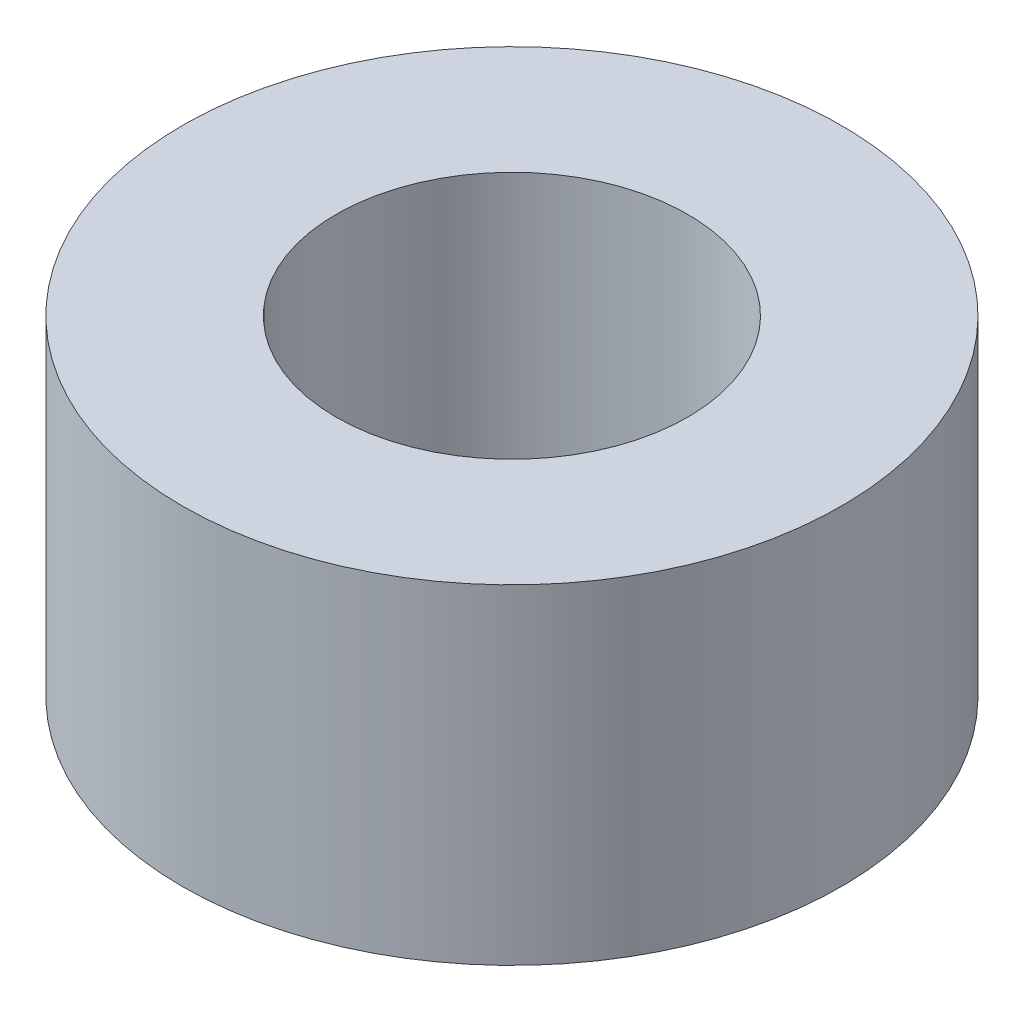
from build123d import *

# Parameters (mm, degrees)
SKETCH1_R           = 3
SKETCH1_R_2         = 1.6
BOSS_EXTRUDE1_DEPTH = 3


with BuildPart() as part:
    # Sketch1 → Boss-Extrude1 (new body)
    with BuildSketch(Plane(origin=(0, 0, 0), x_dir=(1, 0, 0), z_dir=(0, 1, 0))):
        Circle(SKETCH1_R)
        Circle(SKETCH1_R_2, mode=Mode.SUBTRACT)
    extrude(amount=BOSS_EXTRUDE1_DEPTH)


solid = part.part
